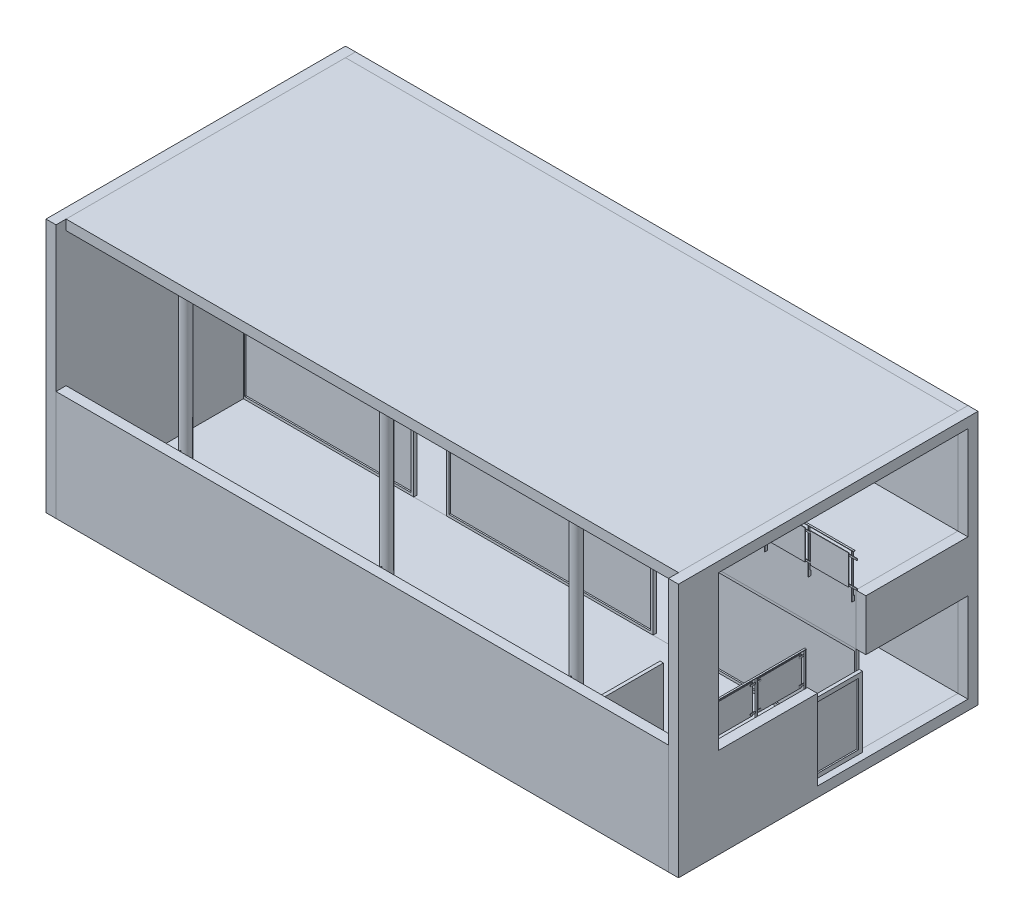
from build123d import *

# Parameters (mm, degrees)
SKETCH1_W              = 18592.8
SKETCH1_H              = 5384.8
BOSS_EXTRUDE1_DEPTH    = 304.8
SKETCH2_W              = 18592.8
SKETCH2_H              = 3098.8
BOSS_EXTRUDE2_DEPTH    = 1549.4
SKETCH5_W              = 18592.8
SKETCH5_H              = 3098.8
BOSS_EXTRUDE5_DEPTH    = 304.8
SKETCH6_W              = 18592.8
SKETCH6_H              = 4572
BOSS_EXTRUDE6_DEPTH    = 304.8
SKETCH7_W              = 18592.8
SKETCH7_H              = 2717.8
BOSS_EXTRUDE7_DEPTH    = 101.6
SKETCH8_W              = 990.6
SKETCH8_H              = 2641.6
SKETCH8_W_2            = 5054.6
SKETCH8_H_2            = 2565.4
SKETCH8_W_3            = 6121.4
CUT_EXTRUDE1_DEPTH     = 19822.636630712
SKETCH9_W              = 5054.6
SKETCH9_H              = 2565.4
BOSS_EXTRUDE8_DEPTH    = 6.35
SKETCH9_W_2            = 6121.4
BOSS_EXTRUDE8_2_DEPTH  = 6.35
BOSS_EXTRUDE8_3_DEPTH  = 6.35
SKETCH4_W              = 18592.8
SKETCH4_H              = 8483.6
BOSS_EXTRUDE3_DEPTH    = 304.8
BOSS_EXTRUDE9_DEPTH    = 304.8
SKETCH11_W             = 10972.8
SKETCH11_H             = 2844.8
BOSS_EXTRUDE10_DEPTH   = 101.6
SKETCH12_W             = 10896.6
SKETCH12_H             = 2692.4
CUT_EXTRUDE2_DEPTH     = 21742.035003881
SKETCH13_W             = 10896.6
SKETCH13_H             = 2692.4
BOSS_EXTRUDE11_DEPTH   = 12.7
BOSS_EXTRUDE16_DEPTH   = 6.35
LPATTERN1_COUNT        = 15
LPATTERN1_PITCH        = 1320.8
SKETCH20_W             = 18548.35
SKETCH20_H             = 50.8
BOSS_EXTRUDE17_DEPTH   = 12.7
SKETCH21_W             = 152.4
SKETCH21_H             = 50.8
BOSS_EXTRUDE18_DEPTH   = 12.7
LPATTERN2_START        = 63.5
LPATTERN2_OUTLINE_W    = 152.4
LPATTERN2_OUTLINE_H    = 50.8
LPATTERN2_DEPTH        = 12.7
SKETCH22_W             = 1155.7
SKETCH22_H             = 901.7
BOSS_EXTRUDE19_DEPTH   = 12.7
LPATTERN4_COUNT        = 14
LPATTERN4_PITCH        = 1320.8
SKETCH15_W             = 18592.8
SKETCH15_H             = 3340.1
BOSS_EXTRUDE12_DEPTH   = 304.8
SKETCH16_R             = 152.4
BOSS_EXTRUDE13_DEPTH   = 7112
BOSS_EXTRUDE13_2_DEPTH = 7112
BOSS_EXTRUDE13_3_DEPTH = 7112
SKETCH17_W             = 12.7
SKETCH17_H             = 241.3
BOSS_EXTRUDE14_DEPTH   = 254
SKETCH31_W             = 2438.4
SKETCH31_H             = 2222.5
BOSS_EXTRUDE26_DEPTH   = 101.6
SKETCH3_W              = 9093.2
SKETCH3_H              = 7721.6
SKETCH3_W_2            = 2997.2
SKETCH3_H_2            = 2413
BOSS_EXTRUDE4_DEPTH    = 304.8
SKETCH18_W             = 9093.2
SKETCH18_H             = 7721.6
BOSS_EXTRUDE15_DEPTH   = 304.8
SKETCH23_W             = 1574.8
SKETCH23_H             = 2133.6
BOSS_EXTRUDE20_DEPTH   = 101.6
SKETCH24_W             = 1371.6
SKETCH24_H             = 1879.6
CUT_EXTRUDE3_DEPTH     = 101.6
SKETCH25_W             = 1371.6
SKETCH25_H             = 1879.6
BOSS_EXTRUDE21_DEPTH   = 6.35
BOSS_EXTRUDE22_DEPTH   = 6.35
LPATTERN5_COUNT        = 3
LPATTERN5_PITCH        = 1473.2
SKETCH27_W             = 50.8
SKETCH27_H             = 2978.15
BOSS_EXTRUDE23_DEPTH   = 12.7
SKETCH28_W             = 152.4
SKETCH28_H             = 50.8
BOSS_EXTRUDE24_DEPTH   = 12.7
LPATTERN6_COUNT        = 2
LPATTERN6_PITCH        = 1473.2
SKETCH30_W             = 1308.1
SKETCH30_H             = 889
BOSS_EXTRUDE25_DEPTH   = 12.7
LPATTERN7_COUNT        = 2
LPATTERN7_PITCH        = 1473.2


with BuildPart() as part:
    # Sketch1 → Boss-Extrude1 (new body)
    with BuildSketch(Plane(origin=(0, 0, 0), x_dir=(1, 0, 0), z_dir=(0, 1, 0))):
        with Locations((9296.4, -2692.4)):
            Rectangle(SKETCH1_W, SKETCH1_H)
    extrude(amount=-BOSS_EXTRUDE1_DEPTH)


with BuildPart() as body_2:
    # Sketch2 → Boss-Extrude2 (new body)
    with BuildSketch(Plane(origin=(0, 4267.2, 0), x_dir=(1, 0, 0), z_dir=(0, 1, 0))):
        with Locations((9296.4, 1549.4)):
            Rectangle(SKETCH2_W, SKETCH2_H)
    extrude(amount=-BOSS_EXTRUDE2_DEPTH)


with BuildPart() as body_3:
    # Sketch5 → Boss-Extrude5 (new body)
    with BuildSketch(Plane(origin=(0, 0, 0), x_dir=(1, 0, 0), z_dir=(0, 1, 0))):
        with Locations((9296.4, 1549.4)):
            Rectangle(SKETCH5_W, SKETCH5_H)
    extrude(amount=-BOSS_EXTRUDE5_DEPTH)

    # Sketch6 → Boss-Extrude6 (add)
    with BuildSketch(Plane(origin=(0, 0, -3098.8), x_dir=(-1, 0, 0), z_dir=(0, 0, -1))):
        with Locations((-9296.4, 1981.2)):
            Rectangle(SKETCH6_W, SKETCH6_H)
    extrude(amount=BOSS_EXTRUDE6_DEPTH)


with BuildPart() as body_4:
    # Sketch7 → Boss-Extrude7 (new body)
    with BuildSketch(Plane.XY):
        with Locations((9296.4, 1358.9)):
            Rectangle(SKETCH7_W, SKETCH7_H)
    extrude(amount=-BOSS_EXTRUDE7_DEPTH)

    # Sketch8 → Cut-Extrude1 (cut, through all)
    with BuildSketch(Plane.XY):
        with Locations((5664.2, 1320.8)):
            Rectangle(SKETCH8_W, SKETCH8_H)
        with Locations((16027.4, 1358.9)):
            Rectangle(SKETCH8_W_2, SKETCH8_H_2)
        with Locations((12928.6, 1320.8)):
            Rectangle(SKETCH8_W, SKETCH8_H)
        with Locations((9296.4, 1358.9)):
            Rectangle(SKETCH8_W_3, SKETCH8_H_2)
        with Locations((2565.4, 1358.9)):
            Rectangle(SKETCH8_W_2, SKETCH8_H_2)
    extrude(amount=-CUT_EXTRUDE1_DEPTH, mode=Mode.SUBTRACT)


with BuildPart() as body_5:
    # Sketch9 → Boss-Extrude8 (new, symmetric)
    with BuildSketch(Plane.XY.offset(-50.8)):
        with Locations((2565.4, 1358.9)):
            Rectangle(SKETCH9_W, SKETCH9_H)
    extrude(amount=BOSS_EXTRUDE8_DEPTH, both=True)


with BuildPart() as body_6:
    # Sketch9 → Boss-Extrude8 2 (new, symmetric)
    with BuildSketch(Plane.XY.offset(-50.8)):
        with Locations((9296.4, 1358.9)):
            Rectangle(SKETCH9_W_2, SKETCH9_H)
    extrude(amount=BOSS_EXTRUDE8_2_DEPTH, both=True)


with BuildPart() as body_7:
    # Sketch9 → Boss-Extrude8 3 (new, symmetric)
    with BuildSketch(Plane.XY.offset(-50.8)):
        with Locations((16027.4, 1358.9)):
            Rectangle(SKETCH9_W, SKETCH9_H)
    extrude(amount=BOSS_EXTRUDE8_3_DEPTH, both=True)


with BuildPart() as body_8:
    # Sketch4 → Boss-Extrude3 (new body)
    with BuildSketch(Plane(origin=(0, 7112, 0), x_dir=(1, 0, 0), z_dir=(0, 1, 0))):
        with Locations((9296.4, -1143)):
            Rectangle(SKETCH4_W, SKETCH4_H)
    extrude(amount=BOSS_EXTRUDE3_DEPTH)


with BuildPart() as body_9:
    # Sketch10 → Boss-Extrude9 (new body)
    with BuildSketch(Plane.XY.offset(-3098.8)):
        Polygon((0, 7416.8), (18592.8, 7416.8), (18592.8, 4267.2), (14782.8, 4267.2), (14782.8, 7112), (3810, 7112), (3810, 4267.2), (0, 4267.2), align=None)
    extrude(amount=-BOSS_EXTRUDE9_DEPTH)


with BuildPart() as body_10:
    # Sketch11 → Boss-Extrude10 (new body)
    with BuildSketch(Plane.XY.offset(-3098.8)):
        with Locations((9296.4, 5689.6)):
            Rectangle(SKETCH11_W, SKETCH11_H)
    extrude(amount=-BOSS_EXTRUDE10_DEPTH)

    # Sketch12 → Cut-Extrude2 (cut, through all)
    with BuildSketch(Plane.XY.offset(-3098.8)):
        with Locations((9296.4, 5689.6)):
            Rectangle(SKETCH12_W, SKETCH12_H)
    extrude(amount=-CUT_EXTRUDE2_DEPTH, mode=Mode.SUBTRACT)


with BuildPart() as body_11:
    # Sketch13 → Boss-Extrude11 (new body)
    with BuildSketch(Plane.XY.offset(-3149.6)):
        with Locations((9296.4, 5689.6)):
            Rectangle(SKETCH13_W, SKETCH13_H)
    extrude(amount=BOSS_EXTRUDE11_DEPTH)


with BuildPart() as body_12:
    # Sketch19 → Boss-Extrude16 (new, symmetric)
    with BuildSketch(Plane(origin=(50.8, 0, 0), x_dir=(0, 0, -1), z_dir=(1, 0, 0))):
        Polygon((0, 3962.4), (0, 4114.8), (-25.4, 4114.8), (-25.4, 5308.6), (-76.2, 5308.6), (-76.2, 3962.4), align=None)
    extrude(amount=BOSS_EXTRUDE16_DEPTH, both=True)


with BuildPart() as lpattern1_1:
    # LPattern1: pattern copy
    add(body_12.part.moved(Location(Vector(1, 0, 0) * (1 * LPATTERN1_PITCH))))


with BuildPart() as lpattern1_2:
    # LPattern1: pattern copy
    add(body_12.part.moved(Location(Vector(1, 0, 0) * (2 * LPATTERN1_PITCH))))


with BuildPart() as lpattern1_3:
    # LPattern1: pattern copy
    add(body_12.part.moved(Location(Vector(1, 0, 0) * (3 * LPATTERN1_PITCH))))


with BuildPart() as lpattern1_4:
    # LPattern1: pattern copy
    add(body_12.part.moved(Location(Vector(1, 0, 0) * (4 * LPATTERN1_PITCH))))


with BuildPart() as lpattern1_5:
    # LPattern1: pattern copy
    add(body_12.part.moved(Location(Vector(1, 0, 0) * (5 * LPATTERN1_PITCH))))


with BuildPart() as lpattern1_6:
    # LPattern1: pattern copy
    add(body_12.part.moved(Location(Vector(1, 0, 0) * (6 * LPATTERN1_PITCH))))


with BuildPart() as lpattern1_7:
    # LPattern1: pattern copy
    add(body_12.part.moved(Location(Vector(1, 0, 0) * (7 * LPATTERN1_PITCH))))


with BuildPart() as lpattern1_8:
    # LPattern1: pattern copy
    add(body_12.part.moved(Location(Vector(1, 0, 0) * (8 * LPATTERN1_PITCH))))


with BuildPart() as lpattern1_9:
    # LPattern1: pattern copy
    add(body_12.part.moved(Location(Vector(1, 0, 0) * (9 * LPATTERN1_PITCH))))


with BuildPart() as lpattern1_10:
    # LPattern1: pattern copy
    add(body_12.part.moved(Location(Vector(1, 0, 0) * (10 * LPATTERN1_PITCH))))


with BuildPart() as lpattern1_11:
    # LPattern1: pattern copy
    add(body_12.part.moved(Location(Vector(1, 0, 0) * (11 * LPATTERN1_PITCH))))


with BuildPart() as lpattern1_12:
    # LPattern1: pattern copy
    add(body_12.part.moved(Location(Vector(1, 0, 0) * (12 * LPATTERN1_PITCH))))


with BuildPart() as lpattern1_13:
    # LPattern1: pattern copy
    add(body_12.part.moved(Location(Vector(1, 0, 0) * (13 * LPATTERN1_PITCH))))


with BuildPart() as lpattern1_14:
    # LPattern1: pattern copy
    add(body_12.part.moved(Location(Vector(1, 0, 0) * (14 * LPATTERN1_PITCH))))


with BuildPart() as body_12_1:
    add(body_12.part)

    add(lpattern1_1.part)  # Boss-Extrude17 merges LPattern1_1

    add(lpattern1_2.part)  # Boss-Extrude17 merges LPattern1_2

    add(lpattern1_3.part)  # Boss-Extrude17 merges LPattern1_3

    add(lpattern1_4.part)  # Boss-Extrude17 merges LPattern1_4

    add(lpattern1_5.part)  # Boss-Extrude17 merges LPattern1_5

    add(lpattern1_6.part)  # Boss-Extrude17 merges LPattern1_6

    add(lpattern1_7.part)  # Boss-Extrude17 merges LPattern1_7

    add(lpattern1_8.part)  # Boss-Extrude17 merges LPattern1_8

    add(lpattern1_9.part)  # Boss-Extrude17 merges LPattern1_9

    add(lpattern1_10.part)  # Boss-Extrude17 merges LPattern1_10

    add(lpattern1_11.part)  # Boss-Extrude17 merges LPattern1_11

    add(lpattern1_12.part)  # Boss-Extrude17 merges LPattern1_12

    add(lpattern1_13.part)  # Boss-Extrude17 merges LPattern1_13

    add(lpattern1_14.part)  # Boss-Extrude17 merges LPattern1_14
    # Sketch20 → Boss-Extrude17 (add)
    with BuildSketch(Plane(origin=(0, 5308.6, 0), x_dir=(1, 0, 0), z_dir=(0, 1, 0))):
        with Locations((9318.625, -50.8)):
            Rectangle(SKETCH20_W, SKETCH20_H)
    extrude(amount=BOSS_EXTRUDE17_DEPTH)

    # Sketch21 → Boss-Extrude18 (add)
    with BuildSketch(Plane.XY.offset(76.2)):
        with Locations((133.35, 5156.2)):
            Rectangle(SKETCH21_W, SKETCH21_H)
        with Locations((1289.05, 5156.2)):
            Rectangle(SKETCH21_W, SKETCH21_H)
        with Locations((133.35, 4368.8)):
            Rectangle(SKETCH21_W, SKETCH21_H)
        with Locations((1289.05, 4368.8)):
            Rectangle(SKETCH21_W, SKETCH21_H)
    extrude(amount=-BOSS_EXTRUDE18_DEPTH)

    # LPattern2: read off the stored shape, not the designer's step
    # LPattern2 outline → LPattern2 (add)
    with BuildSketch(Plane.XY.offset(LPATTERN2_START)):
        with Locations((1454.15, 5156.2)):
            Rectangle(LPATTERN2_OUTLINE_W, LPATTERN2_OUTLINE_H)
        with Locations((1454.15, 4368.8)):
            Rectangle(LPATTERN2_OUTLINE_W, LPATTERN2_OUTLINE_H)
        with Locations((2609.85, 5156.2)):
            Rectangle(LPATTERN2_OUTLINE_W, LPATTERN2_OUTLINE_H)
        with Locations((2609.85, 4368.8)):
            Rectangle(LPATTERN2_OUTLINE_W, LPATTERN2_OUTLINE_H)
        with Locations((2774.95, 5156.2)):
            Rectangle(LPATTERN2_OUTLINE_W, LPATTERN2_OUTLINE_H)
        with Locations((2774.95, 4368.8)):
            Rectangle(LPATTERN2_OUTLINE_W, LPATTERN2_OUTLINE_H)
        with Locations((3930.65, 5156.2)):
            Rectangle(LPATTERN2_OUTLINE_W, LPATTERN2_OUTLINE_H)
        with Locations((3930.65, 4368.8)):
            Rectangle(LPATTERN2_OUTLINE_W, LPATTERN2_OUTLINE_H)
        with Locations((4095.75, 5156.2)):
            Rectangle(LPATTERN2_OUTLINE_W, LPATTERN2_OUTLINE_H)
        with Locations((4095.75, 4368.8)):
            Rectangle(LPATTERN2_OUTLINE_W, LPATTERN2_OUTLINE_H)
        with Locations((5251.45, 5156.2)):
            Rectangle(LPATTERN2_OUTLINE_W, LPATTERN2_OUTLINE_H)
        with Locations((5251.45, 4368.8)):
            Rectangle(LPATTERN2_OUTLINE_W, LPATTERN2_OUTLINE_H)
        with Locations((5416.55, 5156.2)):
            Rectangle(LPATTERN2_OUTLINE_W, LPATTERN2_OUTLINE_H)
        with Locations((5416.55, 4368.8)):
            Rectangle(LPATTERN2_OUTLINE_W, LPATTERN2_OUTLINE_H)
        with Locations((6572.25, 5156.2)):
            Rectangle(LPATTERN2_OUTLINE_W, LPATTERN2_OUTLINE_H)
        with Locations((6572.25, 4368.8)):
            Rectangle(LPATTERN2_OUTLINE_W, LPATTERN2_OUTLINE_H)
        with Locations((6737.35, 5156.2)):
            Rectangle(LPATTERN2_OUTLINE_W, LPATTERN2_OUTLINE_H)
        with Locations((6737.35, 4368.8)):
            Rectangle(LPATTERN2_OUTLINE_W, LPATTERN2_OUTLINE_H)
        with Locations((7893.05, 5156.2)):
            Rectangle(LPATTERN2_OUTLINE_W, LPATTERN2_OUTLINE_H)
        with Locations((7893.05, 4368.8)):
            Rectangle(LPATTERN2_OUTLINE_W, LPATTERN2_OUTLINE_H)
        with Locations((8058.15, 5156.2)):
            Rectangle(LPATTERN2_OUTLINE_W, LPATTERN2_OUTLINE_H)
        with Locations((8058.15, 4368.8)):
            Rectangle(LPATTERN2_OUTLINE_W, LPATTERN2_OUTLINE_H)
        with Locations((9213.85, 5156.2)):
            Rectangle(LPATTERN2_OUTLINE_W, LPATTERN2_OUTLINE_H)
        with Locations((9213.85, 4368.8)):
            Rectangle(LPATTERN2_OUTLINE_W, LPATTERN2_OUTLINE_H)
        with Locations((9378.95, 5156.2)):
            Rectangle(LPATTERN2_OUTLINE_W, LPATTERN2_OUTLINE_H)
        with Locations((9378.95, 4368.8)):
            Rectangle(LPATTERN2_OUTLINE_W, LPATTERN2_OUTLINE_H)
        with Locations((10534.65, 5156.2)):
            Rectangle(LPATTERN2_OUTLINE_W, LPATTERN2_OUTLINE_H)
        with Locations((10534.65, 4368.8)):
            Rectangle(LPATTERN2_OUTLINE_W, LPATTERN2_OUTLINE_H)
        with Locations((10699.75, 5156.2)):
            Rectangle(LPATTERN2_OUTLINE_W, LPATTERN2_OUTLINE_H)
        with Locations((10699.75, 4368.8)):
            Rectangle(LPATTERN2_OUTLINE_W, LPATTERN2_OUTLINE_H)
        with Locations((11855.45, 5156.2)):
            Rectangle(LPATTERN2_OUTLINE_W, LPATTERN2_OUTLINE_H)
        with Locations((11855.45, 4368.8)):
            Rectangle(LPATTERN2_OUTLINE_W, LPATTERN2_OUTLINE_H)
        with Locations((12020.55, 5156.2)):
            Rectangle(LPATTERN2_OUTLINE_W, LPATTERN2_OUTLINE_H)
        with Locations((12020.55, 4368.8)):
            Rectangle(LPATTERN2_OUTLINE_W, LPATTERN2_OUTLINE_H)
        with Locations((13176.25, 5156.2)):
            Rectangle(LPATTERN2_OUTLINE_W, LPATTERN2_OUTLINE_H)
        with Locations((13176.25, 4368.8)):
            Rectangle(LPATTERN2_OUTLINE_W, LPATTERN2_OUTLINE_H)
        with Locations((13341.35, 5156.2)):
            Rectangle(LPATTERN2_OUTLINE_W, LPATTERN2_OUTLINE_H)
        with Locations((13341.35, 4368.8)):
            Rectangle(LPATTERN2_OUTLINE_W, LPATTERN2_OUTLINE_H)
        with Locations((14497.05, 5156.2)):
            Rectangle(LPATTERN2_OUTLINE_W, LPATTERN2_OUTLINE_H)
        with Locations((14497.05, 4368.8)):
            Rectangle(LPATTERN2_OUTLINE_W, LPATTERN2_OUTLINE_H)
        with Locations((14662.15, 5156.2)):
            Rectangle(LPATTERN2_OUTLINE_W, LPATTERN2_OUTLINE_H)
        with Locations((14662.15, 4368.8)):
            Rectangle(LPATTERN2_OUTLINE_W, LPATTERN2_OUTLINE_H)
        with Locations((15817.85, 5156.2)):
            Rectangle(LPATTERN2_OUTLINE_W, LPATTERN2_OUTLINE_H)
        with Locations((15817.85, 4368.8)):
            Rectangle(LPATTERN2_OUTLINE_W, LPATTERN2_OUTLINE_H)
        with Locations((15982.95, 5156.2)):
            Rectangle(LPATTERN2_OUTLINE_W, LPATTERN2_OUTLINE_H)
        with Locations((15982.95, 4368.8)):
            Rectangle(LPATTERN2_OUTLINE_W, LPATTERN2_OUTLINE_H)
        with Locations((17138.65, 5156.2)):
            Rectangle(LPATTERN2_OUTLINE_W, LPATTERN2_OUTLINE_H)
        with Locations((17138.65, 4368.8)):
            Rectangle(LPATTERN2_OUTLINE_W, LPATTERN2_OUTLINE_H)
        with Locations((17303.75, 5156.2)):
            Rectangle(LPATTERN2_OUTLINE_W, LPATTERN2_OUTLINE_H)
        with Locations((17303.75, 4368.8)):
            Rectangle(LPATTERN2_OUTLINE_W, LPATTERN2_OUTLINE_H)
        with Locations((18459.45, 5156.2)):
            Rectangle(LPATTERN2_OUTLINE_W, LPATTERN2_OUTLINE_H)
        with Locations((18459.45, 4368.8)):
            Rectangle(LPATTERN2_OUTLINE_W, LPATTERN2_OUTLINE_H)
        with Locations((18624.55, 5156.2)):
            Rectangle(LPATTERN2_OUTLINE_W, LPATTERN2_OUTLINE_H)
        with Locations((18624.55, 4368.8)):
            Rectangle(LPATTERN2_OUTLINE_W, LPATTERN2_OUTLINE_H)
    extrude(amount=LPATTERN2_DEPTH)


with BuildPart() as body_13:
    # Sketch22 → Boss-Extrude19 (new body)
    with BuildSketch(Plane.XY.offset(76.2)):
        with Locations((711.2, 4768.85)):
            Rectangle(SKETCH22_W, SKETCH22_H)
    extrude(amount=BOSS_EXTRUDE19_DEPTH)


with BuildPart() as lpattern4_1:
    # LPattern4: pattern copy
    add(body_13.part.moved(Location(Vector(1, 0, 0) * (1 * LPATTERN4_PITCH))))


with BuildPart() as lpattern4_2:
    # LPattern4: pattern copy
    add(body_13.part.moved(Location(Vector(1, 0, 0) * (2 * LPATTERN4_PITCH))))


with BuildPart() as lpattern4_3:
    # LPattern4: pattern copy
    add(body_13.part.moved(Location(Vector(1, 0, 0) * (3 * LPATTERN4_PITCH))))


with BuildPart() as lpattern4_4:
    # LPattern4: pattern copy
    add(body_13.part.moved(Location(Vector(1, 0, 0) * (4 * LPATTERN4_PITCH))))


with BuildPart() as lpattern4_5:
    # LPattern4: pattern copy
    add(body_13.part.moved(Location(Vector(1, 0, 0) * (5 * LPATTERN4_PITCH))))


with BuildPart() as lpattern4_6:
    # LPattern4: pattern copy
    add(body_13.part.moved(Location(Vector(1, 0, 0) * (6 * LPATTERN4_PITCH))))


with BuildPart() as lpattern4_7:
    # LPattern4: pattern copy
    add(body_13.part.moved(Location(Vector(1, 0, 0) * (7 * LPATTERN4_PITCH))))


with BuildPart() as lpattern4_8:
    # LPattern4: pattern copy
    add(body_13.part.moved(Location(Vector(1, 0, 0) * (8 * LPATTERN4_PITCH))))


with BuildPart() as lpattern4_9:
    # LPattern4: pattern copy
    add(body_13.part.moved(Location(Vector(1, 0, 0) * (9 * LPATTERN4_PITCH))))


with BuildPart() as lpattern4_10:
    # LPattern4: pattern copy
    add(body_13.part.moved(Location(Vector(1, 0, 0) * (10 * LPATTERN4_PITCH))))


with BuildPart() as lpattern4_11:
    # LPattern4: pattern copy
    add(body_13.part.moved(Location(Vector(1, 0, 0) * (11 * LPATTERN4_PITCH))))


with BuildPart() as lpattern4_12:
    # LPattern4: pattern copy
    add(body_13.part.moved(Location(Vector(1, 0, 0) * (12 * LPATTERN4_PITCH))))


with BuildPart() as lpattern4_13:
    # LPattern4: pattern copy
    add(body_13.part.moved(Location(Vector(1, 0, 0) * (13 * LPATTERN4_PITCH))))


with BuildPart() as body_27:
    # Sketch15 → Boss-Extrude12 (new body)
    with BuildSketch(Plane.XY.offset(5384.8)):
        with Locations((9296.4, 1365.25)):
            Rectangle(SKETCH15_W, SKETCH15_H)
    extrude(amount=BOSS_EXTRUDE12_DEPTH)


with BuildPart() as body_28:
    # Sketch16 → Boss-Extrude13 (new body)
    with BuildSketch(Plane(origin=(0, 0, 0), x_dir=(1, 0, 0), z_dir=(0, 1, 0))):
        with Locations(Location((9491.98, -5143.5, 0), (0, 0, 90))):
            Circle(SKETCH16_R)
    extrude(amount=BOSS_EXTRUDE13_DEPTH)


with BuildPart() as body_29:
    # Sketch16 → Boss-Extrude13 2 (new body)
    with BuildSketch(Plane(origin=(0, 0, 0), x_dir=(1, 0, 0), z_dir=(0, 1, 0))):
        with Locations(Location((15247.62, -5143.5, 0), (0, 0, 90))):
            Circle(SKETCH16_R)
    extrude(amount=BOSS_EXTRUDE13_2_DEPTH)


    add(body_28.part)  # Boss-Extrude14 merges body 28


with BuildPart() as body_30:
    # Sketch16 → Boss-Extrude13 3 (new body)
    with BuildSketch(Plane(origin=(0, 0, 0), x_dir=(1, 0, 0), z_dir=(0, 1, 0))):
        with Locations(Location((3390.9, -5143.5, 0), (0, 0, 90))):
            Circle(SKETCH16_R)
    extrude(amount=BOSS_EXTRUDE13_3_DEPTH)


with BuildPart() as body_29_1:
    add(body_29.part)

    add(body_30.part)  # Boss-Extrude14 merges body 30
    # Sketch17 → Boss-Extrude14 (add)
    with BuildSketch(Plane(origin=(0, 2730.5, 0), x_dir=(1, 0, 0), z_dir=(0, 1, 0))):
        with Locations((15247.62, -5264.15)):
            Rectangle(SKETCH17_W, SKETCH17_H)
        with Locations((9491.98, -5264.15)):
            Rectangle(SKETCH17_W, SKETCH17_H)
        with Locations((3390.9, -5264.15)):
            Rectangle(SKETCH17_W, SKETCH17_H)
    extrude(amount=BOSS_EXTRUDE14_DEPTH)


with BuildPart() as body_29_2:
    # Sketch31 → Boss-Extrude26 (new body)
    with BuildSketch(Plane(origin=(15595.6, 0, 0), x_dir=(0, 0, -1), z_dir=(1, 0, 0))):
        with Locations((-4165.6, 1263.65)):
            Rectangle(SKETCH31_W, SKETCH31_H)
    extrude(amount=BOSS_EXTRUDE26_DEPTH)


with BuildPart() as body_30_2:
    # Sketch3 → Boss-Extrude4 (new body)
    with BuildSketch(Plane.ZY):
        with Locations((1143, 3556)):
            Rectangle(SKETCH3_W, SKETCH3_H)
        with Locations((-1600.2, 1206.5)):
            Rectangle(SKETCH3_W_2, SKETCH3_H_2, mode=Mode.SUBTRACT)
        with Locations((-1600.2, 5473.7)):
            Rectangle(SKETCH3_W_2, SKETCH3_H_2, mode=Mode.SUBTRACT)
    extrude(amount=BOSS_EXTRUDE4_DEPTH)


with BuildPart() as body_31:
    # Sketch18 → Boss-Extrude15 (new body)
    with BuildSketch(Plane(origin=(18592.8, 0, 0), x_dir=(0, 0, -1), z_dir=(1, 0, 0))):
        with Locations((-1143, 3556)):
            Rectangle(SKETCH18_W, SKETCH18_H)
        Polygon((-4470.4, 7112), (-4470.4, 2438.4), (-1473.2, 2438.4), (-1473.2, 0), (3098.8, 0), (3098.8, 2717.8), (0, 2717.8), (0, 4267.2), (3098.8, 4267.2), (3098.8, 7112), align=None, mode=Mode.SUBTRACT)
    extrude(amount=BOSS_EXTRUDE15_DEPTH)


with BuildPart() as body_32:
    # Sketch23 → Boss-Extrude20 (new body)
    with BuildSketch(Plane.ZY.offset(-18592.8)):
        with Locations((685.8, 1066.8)):
            Rectangle(SKETCH23_W, SKETCH23_H)
    extrude(amount=-BOSS_EXTRUDE20_DEPTH)

    # Sketch24 → Cut-Extrude3 (cut)
    with BuildSketch(Plane.ZY.offset(-18592.8)):
        with Locations((711.2, 1066.8)):
            Rectangle(SKETCH24_W, SKETCH24_H)
    extrude(amount=-CUT_EXTRUDE3_DEPTH, mode=Mode.SUBTRACT)


with BuildPart() as body_33:
    # Sketch25 → Boss-Extrude21 (new, symmetric)
    with BuildSketch(Plane.ZY.offset(-18643.6)):
        with Locations((711.2, 1066.8)):
            Rectangle(SKETCH25_W, SKETCH25_H)
    extrude(amount=BOSS_EXTRUDE21_DEPTH, both=True)


with BuildPart() as body_34:
    # Sketch26 → Boss-Extrude22 (new, symmetric)
    with BuildSketch(Plane(origin=(0, 0, 4445), x_dir=(-1, 0, 0), z_dir=(0, 0, -1))):
        Polygon((-18592.8, 2286), (-18567.4, 2286), (-18567.4, 3429), (-18516.6, 3429), (-18516.6, 2133.6), (-18592.8, 2133.6), align=None)
    extrude(amount=BOSS_EXTRUDE22_DEPTH, both=True)


with BuildPart() as lpattern5_1:
    # LPattern5: pattern copy
    add(body_34.part.moved(Location(Vector(0, 0, -1) * (1 * LPATTERN5_PITCH))))


with BuildPart() as lpattern5_2:
    # LPattern5: pattern copy
    add(body_34.part.moved(Location(Vector(0, 0, -1) * (2 * LPATTERN5_PITCH))))


with BuildPart() as body_34_1:
    add(body_34.part)

    add(lpattern5_1.part)  # Boss-Extrude23 merges LPattern5_1

    add(lpattern5_2.part)  # Boss-Extrude23 merges LPattern5_2
    # Sketch27 → Boss-Extrude23 (add)
    with BuildSketch(Plane(origin=(0, 3429, 0), x_dir=(1, 0, 0), z_dir=(0, 1, 0))):
        with Locations((18542, -2962.275)):
            Rectangle(SKETCH27_W, SKETCH27_H)
    extrude(amount=BOSS_EXTRUDE23_DEPTH)

    # Sketch28 → Boss-Extrude24 (add)
    with BuildSketch(Plane.ZY.offset(-18516.6)):
        with Locations((3054.35, 3276.6)):
            Rectangle(SKETCH28_W, SKETCH28_H)
        with Locations((4362.45, 3276.6)):
            Rectangle(SKETCH28_W, SKETCH28_H)
        with Locations((4362.45, 2514.6)):
            Rectangle(SKETCH28_W, SKETCH28_H)
        with Locations((3054.35, 2514.6)):
            Rectangle(SKETCH28_W, SKETCH28_H)
    boss_extrude24 = extrude(amount=-BOSS_EXTRUDE24_DEPTH)

    # LPattern6: Boss-Extrude24 ×2
    with Locations(*[(0, 0, -i * LPATTERN6_PITCH) for i in range(1, LPATTERN6_COUNT)]):
        add(boss_extrude24)


with BuildPart() as body_35:
    # Sketch30 → Boss-Extrude25 (new body)
    with BuildSketch(Plane.ZY.offset(-18516.6)):
        with Locations((3708.4, 2895.6)):
            Rectangle(SKETCH30_W, SKETCH30_H)
    extrude(amount=BOSS_EXTRUDE25_DEPTH)


with BuildPart() as lpattern7_1:
    # LPattern7: pattern copy
    add(body_35.part.moved(Location(Vector(0, 0, -1) * (1 * LPATTERN7_PITCH))))


solid = Compound([part.part, body_2.part, body_3.part, body_4.part, body_5.part, body_6.part, body_7.part, body_8.part, body_9.part, body_10.part, body_11.part, body_12_1.part, body_13.part, lpattern4_1.part, lpattern4_2.part, lpattern4_3.part, lpattern4_4.part, lpattern4_5.part, lpattern4_6.part, lpattern4_7.part, lpattern4_8.part, lpattern4_9.part, lpattern4_10.part, lpattern4_11.part, lpattern4_12.part, lpattern4_13.part, body_27.part, body_29_1.part, body_29_2.part, body_30_2.part, body_31.part, body_32.part, body_33.part, body_34_1.part, body_35.part, lpattern7_1.part])
